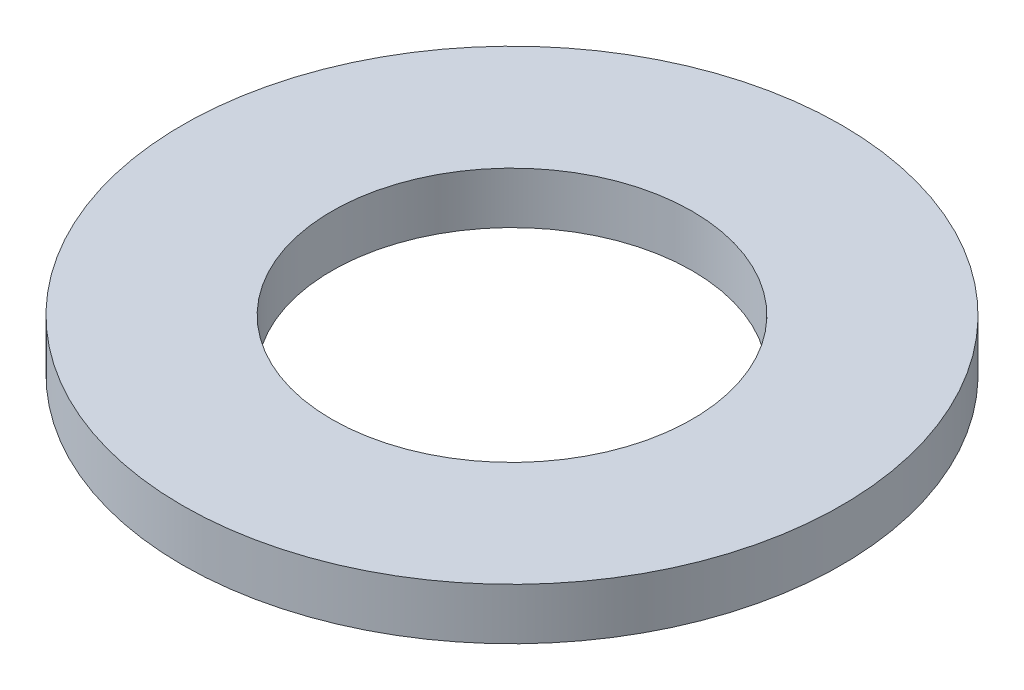
from build123d import *

# Parameters (mm, degrees)
SZKIC1_W = 29
SZKIC1_H = 10


with BuildPart() as part:
    # Szkic1 → Obrót1 (revolve)
    with BuildSketch(Plane.XY):
        with Locations((-49.5, 5)):
            Rectangle(SZKIC1_W, SZKIC1_H)
    revolve(axis=Axis((0, 0, 0), (0, 1, 0)))


solid = part.part
